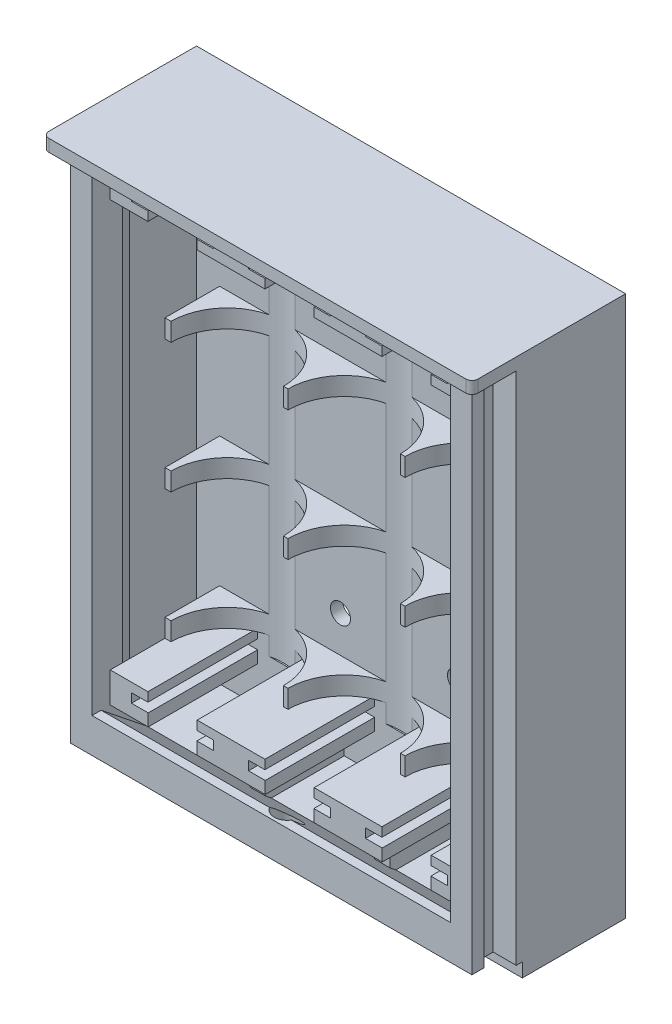
from build123d import *

# Parameters (mm, degrees)
IZIM1_W                      = 63
IZIM1_H                      = 85
Y_KSEKLIK_EKSTR_ZYON1_DEPTH  = 2
IZIM2_W                      = 63
IZIM2_H                      = 85
IZIM2_W_2                    = 59
IZIM2_H_2                    = 81
Y_KSEKLIK_EKSTR_ZYON2_DEPTH  = 21
IZIM3_W                      = 59
IZIM3_H                      = 2
Y_KSEKLIK_EKSTR_ZYON3_DEPTH  = 18
IZIM4_W                      = 2.5
IZIM4_H                      = 2
Y_KSEKLIK_EKSTR_ZYON4_DEPTH  = 18
Y_KSEKLIK_EKSTR_ZYON5_DEPTH  = 73
IZIM6_R                      = 9.25
KES_EKSTR_ZYON1_DEPTH        = 73
IZIM7_W                      = 57
IZIM7_H                      = 3
IZIM7_H_2                    = 18.336666667
IZIM7_H_3                    = 18.333333333
IZIM7_H_4                    = 18.33
KES_EKSTR_ZYON2_DEPTH        = 18
IZIM8_R                      = 1.65
KES_EKSTR_ZYON3_DEPTH        = 18
Y_KSEKLIK_EKSTR_ZYON7_DEPTH  = 18
KES_EKSTR_ZYON4_START        = -18
IZIM10_W                     = 8
IZIM10_H                     = 2
KES_EKSTR_ZYON4_DEPTH        = 18
IZIM11_W                     = 2.5
IZIM11_H                     = 2
KES_EKSTR_ZYON5_DEPTH        = 5
IZIM12_W                     = 1
IZIM12_H                     = 18.333333333
IZIM12_H_2                   = 18.33
IZIM12_H_3                   = 18.336666667
KES_EKSTR_ZYON6_DEPTH        = 9
IZIM13_W                     = 1.5
IZIM13_H                     = 2
Y_KSEKLIK_EKSTR_ZYON8_DEPTH  = 85
IZIM14_W                     = 66
IZIM14_H                     = 2
Y_KSEKLIK_EKSTR_ZYON9_DEPTH  = 2.3
Y_KSEKLIK_EKSTR_ZYON10_START = -2
Y_KSEKLIK_EKSTR_ZYON10_DEPTH = 2
IZIM16_W                     = 3.8
IZIM16_H                     = 18
Y_KSEKLIK_EKSTR_ZYON11_DEPTH = 85
Y_KSEKLIK_EKSTR_ZYON12_START = -2
Y_KSEKLIK_EKSTR_ZYON12_DEPTH = 2
KES_EKSTR_ZYON7_START        = -7
KES_EKSTR_ZYON7_DEPTH        = 81
Y_KSEKLIK_EKSTR_ZYON13_DEPTH = 4
KES_EKSTR_ZYON8_DEPTH        = 59
IZIM21_W                     = 2.5
IZIM21_H                     = 13
Y_KSEKLIK_EKSTR_ZYON14_DEPTH = 4
KES_EKSTR_ZYON9_START        = -6
IZIM22_R                     = 2.1
KES_EKSTR_ZYON9_DEPTH        = 6
IZIM23_W                     = 70.6
IZIM23_H                     = 8.3
KES_EKSTR_ZYON10_DEPTH       = 2.3
Y_KSEKLIK_EKSTR_ZYON15_DEPTH = 59
KES_EKSTR_ZYON11_START       = -2.3
KES_EKSTR_ZYON11_DEPTH       = 2.3


with BuildPart() as part:
    # Çizim1 → Yükseklik-Ekstrüzyon1 (new body)
    with BuildSketch(Plane.XY):
        with Locations((31.5, 42.5)):
            Rectangle(IZIM1_W, IZIM1_H)
    extrude(amount=Y_KSEKLIK_EKSTR_ZYON1_DEPTH)

    # Çizim2 → Yükseklik-Ekstrüzyon2 (add)
    with BuildSketch(Plane.XY.offset(2)):
        with Locations((31.5, 42.5)):
            Rectangle(IZIM2_W, IZIM2_H)
        with Locations((31.5, 42.5)):
            Rectangle(IZIM2_W_2, IZIM2_H_2, mode=Mode.SUBTRACT)
    extrude(amount=Y_KSEKLIK_EKSTR_ZYON2_DEPTH)

    # Çizim3 → Yükseklik-Ekstrüzyon3 (add)
    with BuildSketch(Plane.XY.offset(2)):
        with Locations((31.5, 80)):
            Rectangle(IZIM3_W, IZIM3_H)
        with Locations((31.5, 5)):
            Rectangle(IZIM3_W, IZIM3_H)
    extrude(amount=Y_KSEKLIK_EKSTR_ZYON3_DEPTH)

    # Çizim4 → Yükseklik-Ekstrüzyon4 (add)
    with BuildSketch(Plane.XY.offset(2)):
        with Locations((21.25, 82)):
            Rectangle(IZIM4_W, IZIM4_H)
        with Locations((41.75, 82)):
            Rectangle(IZIM4_W, IZIM4_H)
        with Locations((41.75, 3)):
            Rectangle(IZIM4_W, IZIM4_H)
        with Locations((21.25, 3)):
            Rectangle(IZIM4_W, IZIM4_H)
    extrude(amount=Y_KSEKLIK_EKSTR_ZYON4_DEPTH)

    # Çizim5 → Yükseklik-Ekstrüzyon5 (add)
    with BuildSketch(Plane(origin=(0, 79, 0), x_dir=(-1, 0, 0), z_dir=(0, -1, 0))):
        with BuildLine():
            Line((-2, -11), (-3, -11))
            ThreePointArc((-3, -11), (-4.993261454, -5.263952086), (-10.113999064, -2))
            Line((-10.113999064, -2), (-2, -2))
            Line((-2, -2), (-2, -11))
        make_face()
        with BuildLine():
            Line((-40.75, -11), (-41.5, -11))
            ThreePointArc((-41.5, -11), (-43.493261454, -5.263952086), (-48.613999064, -2))
            Line((-48.613999064, -2), (-33.636000936, -2))
            ThreePointArc((-33.636000936, -2), (-38.756738546, -5.263952086), (-40.75, -11))
        make_face()
        with BuildLine():
            Line((-61, -2), (-61, -11))
            Line((-61, -11), (-60, -11))
            ThreePointArc((-60, -11), (-58.006738546, -5.263952086), (-52.886000936, -2))
            Line((-52.886000936, -2), (-61, -2))
        make_face()
        with BuildLine():
            Line((-21.5, -11), (-22.25, -11))
            ThreePointArc((-22.25, -11), (-24.243261454, -5.263952086), (-29.363999064, -2))
            Line((-29.363999064, -2), (-14.386000936, -2))
            ThreePointArc((-14.386000936, -2), (-19.506738546, -5.263952086), (-21.5, -11))
        make_face()
    extrude(amount=Y_KSEKLIK_EKSTR_ZYON5_DEPTH)

    # Çizim6 → Kes-Ekstrüzyon1 (cut)
    with BuildSketch(Plane.XZ.offset(-79)):
        with Locations((12.25, 11)):
            Circle(IZIM6_R)
        with Locations((31.5, 11)):
            Circle(IZIM6_R)
        with Locations((50.75, 11)):
            Circle(IZIM6_R)
    extrude(amount=KES_EKSTR_ZYON1_DEPTH, mode=Mode.SUBTRACT)

    # Çizim7 → Kes-Ekstrüzyon2 (cut)
    with BuildSketch(Plane.XY.offset(20)):
        with Locations((31.5, 77.5)):
            Rectangle(IZIM7_W, IZIM7_H)
        with Locations((31.5, 7.5)):
            Rectangle(IZIM7_W, IZIM7_H)
        with Locations((31.5, 21.168333334)):
            Rectangle(IZIM7_W, IZIM7_H_2)
        with Locations((31.5, 63.833333334)):
            Rectangle(IZIM7_W, IZIM7_H_3)
        with Locations((31.5, 42.501666667)):
            Rectangle(IZIM7_W, IZIM7_H_4)
    extrude(amount=-KES_EKSTR_ZYON2_DEPTH, mode=Mode.SUBTRACT)

    # Çizim8 → Kes-Ekstrüzyon3 (cut)
    with BuildSketch(Plane.XY.offset(2)):
        with Locations((21.875, 67)):
            Circle(IZIM8_R)
        with Locations((41.125, 67)):
            Circle(IZIM8_R)
        with Locations(Location((41.125, 18, 0), (0, 0, 180))):
            Circle(IZIM8_R)
        with Locations(Location((21.875, 18, 0), (0, 0, 180))):
            Circle(IZIM8_R)
    extrude(amount=-KES_EKSTR_ZYON3_DEPTH, mode=Mode.SUBTRACT)

    # Çizim9 → Yükseklik-Ekstrüzyon7 (add)
    with BuildSketch(Plane.XY.offset(20)):
        Polygon((5.5, 6), (5.5, 7.5), (8.2, 7.5), (8.2, 9), (2, 9), (2, 6), align=None)
        Polygon((19, 7.5), (19, 6), (21.25, 6), (21.25, 9), (16.3, 9), (16.3, 7.5), align=None)
        Polygon((24.75, 6), (21.25, 6), (21.25, 9), (27.45, 9), (27.45, 7.5), (24.75, 7.5), align=None)
        Polygon((35.55, 9), (35.55, 7.5), (38.25, 7.5), (38.25, 6), (41.75, 6), (41.75, 9), align=None)
        Polygon((44, 6), (41.75, 6), (41.75, 9), (46.7, 9), (46.7, 7.5), (44, 7.5), align=None)
        Polygon((54.8, 9), (54.8, 7.5), (57.5, 7.5), (57.5, 6), (61, 6), (61, 9), align=None)
        Polygon((8.2, 77.5), (5.5, 77.5), (5.5, 79), (2, 79), (2, 76), (8.2, 76), align=None)
        Polygon((21.25, 79), (19, 79), (19, 77.5), (16.3, 77.5), (16.3, 76), (21.25, 76), align=None)
        Polygon((24.75, 79), (21.25, 79), (21.25, 76), (27.45, 76), (27.45, 77.5), (24.75, 77.5), align=None)
        Polygon((41.75, 79), (38.25, 79), (38.25, 77.5), (35.55, 77.5), (35.55, 76), (41.75, 76), align=None)
        Polygon((44, 79), (41.75, 79), (41.75, 76), (46.7, 76), (46.7, 77.5), (44, 77.5), align=None)
        Polygon((61, 79), (57.5, 79), (57.5, 77.5), (54.8, 77.5), (54.8, 76), (61, 76), align=None)
    extrude(amount=-Y_KSEKLIK_EKSTR_ZYON7_DEPTH)

    # Çizim10 → Kes-Ekstrüzyon4 (cut)
    with BuildSketch(Plane.XY.offset(20).offset(KES_EKSTR_ZYON4_START)):
        with Locations((12.25, 80)):
            Rectangle(IZIM10_W, IZIM10_H)
        with Locations((31.5, 80)):
            Rectangle(IZIM10_W, IZIM10_H)
        with Locations((50.75, 80)):
            Rectangle(IZIM10_W, IZIM10_H)
        with Locations((50.75, 5)):
            Rectangle(IZIM10_W, IZIM10_H)
        with Locations((31.5, 5)):
            Rectangle(IZIM10_W, IZIM10_H)
        with Locations((12.25, 5)):
            Rectangle(IZIM10_W, IZIM10_H)
    extrude(amount=KES_EKSTR_ZYON4_DEPTH, mode=Mode.SUBTRACT)

    # Çizim11 → Kes-Ekstrüzyon5 (cut)
    with BuildSketch(Plane.XY.offset(20)):
        with Locations((21.25, 82)):
            Rectangle(IZIM11_W, IZIM11_H)
        with Locations((41.75, 82)):
            Rectangle(IZIM11_W, IZIM11_H)
        with Locations((41.75, 3)):
            Rectangle(IZIM11_W, IZIM11_H)
        with Locations((21.25, 3)):
            Rectangle(IZIM11_W, IZIM11_H)
    extrude(amount=-KES_EKSTR_ZYON5_DEPTH, mode=Mode.SUBTRACT)

    # Çizim12 → Kes-Ekstrüzyon6 (cut)
    with BuildSketch(Plane.XY.offset(11)):
        with Locations((2.5, 63.833333334)):
            Rectangle(IZIM12_W, IZIM12_H)
        with Locations((2.5, 42.501666667)):
            Rectangle(IZIM12_W, IZIM12_H_2)
        with Locations((2.5, 21.168333334)):
            Rectangle(IZIM12_W, IZIM12_H_3)
        with Locations((60.5, 21.168333334)):
            Rectangle(IZIM12_W, IZIM12_H_3)
        with Locations((60.5, 42.501666667)):
            Rectangle(IZIM12_W, IZIM12_H_2)
        with Locations((60.5, 63.833333334)):
            Rectangle(IZIM12_W, IZIM12_H)
    extrude(amount=-KES_EKSTR_ZYON6_DEPTH, mode=Mode.SUBTRACT)

    # Çizim13 → Yükseklik-Ekstrüzyon8 (add)
    with BuildSketch(Plane.XZ):
        with Locations((-0.75, 22)):
            Rectangle(IZIM13_W, IZIM13_H)
        with Locations((63.75, 22)):
            Rectangle(IZIM13_W, IZIM13_H)
    extrude(amount=-Y_KSEKLIK_EKSTR_ZYON8_DEPTH)

    # Çizim14 → Yükseklik-Ekstrüzyon9 (add)
    with BuildSketch(Plane.XY.offset(23)):
        with Locations((31.5, 84)):
            Rectangle(IZIM14_W, IZIM14_H)
    extrude(amount=Y_KSEKLIK_EKSTR_ZYON9_DEPTH)

    # Çizim15 → Yükseklik-Ekstrüzyon10 (add)
    with BuildSketch(Plane(origin=(0, 85, 0), x_dir=(1, 0, 0), z_dir=(0, 1, 0)).offset(Y_KSEKLIK_EKSTR_ZYON10_START)):
        with BuildLine():
            Line((64.5, -25.3), (65.5, -25.3))
            ThreePointArc((65.5, -25.3), (66.207106781, -25.007106781), (66.5, -24.3))
            Line((66.5, -24.3), (66.5, -20.35))
            ThreePointArc((66.5, -20.35), (65.914213562, -18.935786438), (64.5, -18.35))
            Line((64.5, -18.35), (63, -18.35))
            Line((63, -18.35), (63, -21))
            Line((63, -21), (64.5, -21))
            Line((64.5, -21), (64.5, -25.3))
        make_face()
        with BuildLine():
            Line((0, -21), (0, -18.35))
            Line((0, -18.35), (-1.5, -18.35))
            ThreePointArc((-1.5, -18.35), (-2.914213562, -18.935786438), (-3.5, -20.35))
            Line((-3.5, -20.35), (-3.5, -24.3))
            ThreePointArc((-3.5, -24.3), (-3.207106781, -25.007106781), (-2.5, -25.3))
            Line((-2.5, -25.3), (-1.5, -25.3))
            Line((-1.5, -25.3), (-1.5, -21))
            Line((-1.5, -21), (0, -21))
        make_face()
    extrude(amount=Y_KSEKLIK_EKSTR_ZYON10_DEPTH)

    # Çizim16 → Yükseklik-Ekstrüzyon11 (add)
    with BuildSketch(Plane(origin=(0, 85, 0), x_dir=(1, 0, 0), z_dir=(0, 1, 0))):
        with Locations((64.9, -9)):
            Rectangle(IZIM16_W, IZIM16_H)
        with Locations((-1.9, -9)):
            Rectangle(IZIM16_W, IZIM16_H)
    extrude(amount=-Y_KSEKLIK_EKSTR_ZYON11_DEPTH)

    # Çizim17 → Yükseklik-Ekstrüzyon12 (add)
    with BuildSketch(Plane(origin=(0, 85, 0), x_dir=(1, 0, 0), z_dir=(0, 1, 0)).offset(Y_KSEKLIK_EKSTR_ZYON12_START)):
        with BuildLine():
            Line((66.8, -24.3), (66.8, -18))
            Line((66.8, -18), (63, -18))
            Line((63, -18), (63, -18.35))
            Line((63, -18.35), (64.5, -18.35))
            ThreePointArc((64.5, -18.35), (65.914213562, -18.935786438), (66.5, -20.35))
            Line((66.5, -20.35), (66.5, -24.3))
            ThreePointArc((66.5, -24.3), (66.207106781, -25.007106781), (65.5, -25.3))
            Line((65.5, -25.3), (65.8, -25.3))
            ThreePointArc((65.8, -25.3), (66.507106781, -25.007106781), (66.8, -24.3))
        make_face()
        with BuildLine():
            Line((0, -18), (-3.8, -18))
            Line((-3.8, -18), (-3.8, -24.3))
            ThreePointArc((-3.8, -24.3), (-3.507106781, -25.007106781), (-2.8, -25.3))
            Line((-2.8, -25.3), (-2.5, -25.3))
            ThreePointArc((-2.5, -25.3), (-3.207106781, -25.007106781), (-3.5, -24.3))
            Line((-3.5, -24.3), (-3.5, -20.35))
            ThreePointArc((-3.5, -20.35), (-2.914213562, -18.935786438), (-1.5, -18.35))
            Line((-1.5, -18.35), (0, -18.35))
            Line((0, -18.35), (0, -18))
        make_face()
    extrude(amount=Y_KSEKLIK_EKSTR_ZYON12_DEPTH)

    # Çizim18 → Kes-Ekstrüzyon7 (cut)
    with BuildSketch(Plane.XZ.offset(-76).offset(KES_EKSTR_ZYON7_START)):
        Polygon((2, 18), (-1.8, 13), (-1.8, 2), (2, 2), align=None)
        Polygon((61, 2), (61, 18), (64.8, 13), (64.8, 2), align=None)
    extrude(amount=KES_EKSTR_ZYON7_DEPTH, mode=Mode.SUBTRACT)

    # Çizim19 → Yükseklik-Ekstrüzyon13 (add)
    with BuildSketch(Plane.XZ):
        Polygon((-3.8, 0), (66.8, 0), (66.8, 18), (63, 18), (63, 21), (64.5, 21), (64.5, 23), (-1.5, 23), (-1.5, 21), (0, 21), (0, 18), (-3.8, 18), align=None)
    extrude(amount=Y_KSEKLIK_EKSTR_ZYON13_DEPTH)

    # Çizim20 → Kes-Ekstrüzyon8 (cut)
    with BuildSketch(Plane(origin=(2, 0, 0), x_dir=(0, 0, -1), z_dir=(1, 0, 0))):
        Polygon((-19, 2), (-14, -2), (-2, -2), (-2, 2), align=None)
    extrude(amount=KES_EKSTR_ZYON8_DEPTH, mode=Mode.SUBTRACT)

    # Çizim21 → Yükseklik-Ekstrüzyon14 (add)
    with BuildSketch(Plane.XZ.offset(-2)):
        with Locations((41.75, 8.5)):
            Rectangle(IZIM21_W, IZIM21_H)
        with Locations((21.25, 8.5)):
            Rectangle(IZIM21_W, IZIM21_H)
    extrude(amount=Y_KSEKLIK_EKSTR_ZYON14_DEPTH)

    # Çizim22 → Kes-Ekstrüzyon9 (cut)
    with BuildSketch(Plane.XZ.offset(4).offset(KES_EKSTR_ZYON9_START)):
        with Locations(Location((31.5, 20.4, 0), (0, 0, 270))):
            Circle(IZIM22_R)
    extrude(amount=KES_EKSTR_ZYON9_DEPTH, mode=Mode.SUBTRACT)

    # Çizim23 → Kes-Ekstrüzyon10 (cut)
    with BuildSketch(Plane.XZ.offset(4)):
        with Locations((31.5, 21.15)):
            Rectangle(IZIM23_W, IZIM23_H)
    extrude(amount=-KES_EKSTR_ZYON10_DEPTH, mode=Mode.SUBTRACT)

    # Çizim24 → Yükseklik-Ekstrüzyon15 (add)
    with BuildSketch(Plane(origin=(2, 0, 0), x_dir=(0, 0, -1), z_dir=(1, 0, 0))):
        Polygon((-23, 2), (-23, 4), (-21.5, 4), (-19, 2), align=None)
    extrude(amount=Y_KSEKLIK_EKSTR_ZYON15_DEPTH)

    # Çizim25 → Kes-Ekstrüzyon11 (cut)
    with BuildSketch(Plane.XZ.offset(-2).offset(KES_EKSTR_ZYON11_START)):
        with BuildLine():
            Line((29.934752416, 19), (33.065247584, 19))
            ThreePointArc((33.065247584, 19), (31.5, 22.5), (29.934752416, 19))
        make_face()
    extrude(amount=KES_EKSTR_ZYON11_DEPTH, mode=Mode.SUBTRACT)


solid = part.part
